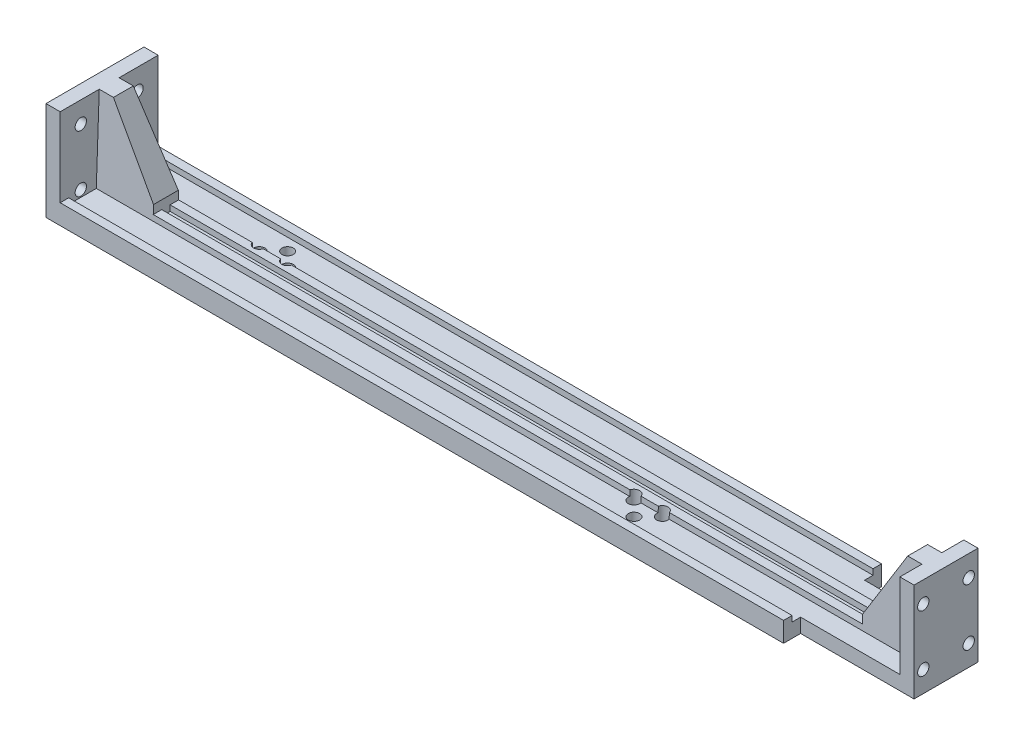
from build123d import *

# Parameters (mm, degrees)
EXTRUDE_1_DEPTH          = 34.54
CUT_EXTRUDE_1_REACH      = 305.978
SKETCH_2_W               = 40
SKETCH_2_H               = 6
SKETCH_3_R               = 2
CUT_EXTRUDE_2_DEPTH      = 5
SKETCH_4_R               = 2
CUT_EXTRUDE_3_DEPTH      = 5
RIB_START                = 5
RIB_7_DEPTH              = 20
RIB_START_2              = 12.730059485
RIB_7_2_DEPTH            = 9.07988103
RIB_START_3              = 275
RIB_19_DEPTH             = 20
RIB_START_4              = 147.269934089
RIB_19_2_DEPTH           = 35.576868781
EXTRUDE_2_REACH          = 301.045
SKETCH_8_W               = 3
SKETCH_8_H               = 2
CUT_EXTRUDE_4_DEPTH      = 304.978058419
CUT_EXTRUDE_4_DEPTH_BACK = 304.978058419
SKETCH_9_W               = 35
SKETCH_9_H               = 3
CUT_EXTRUDE_5_REACH      = 305.978
SKETCH_10_R              = 2
CUT_EXTRUDE_6_REACH      = 305.978
SKETCH_11_R              = 2


with BuildPart() as part:
    # 草图1 → 凸台-拉伸1 (new body)
    with BuildSketch(Plane.XY):
        Polygon((0, 0), (300, 0), (300, 34.78), (295, 34.78), (295, 5), (5, 5), (5, 34.78), (0, 34.78), align=None)
    extrude(amount=EXTRUDE_1_DEPTH)

    # 切除-拉伸1: up to this face of the body (flat: up to its plane)
    cut_extrude_1_end = Plane(part.part.faces().sort_by_distance((297.5, 34.78, 17.27))[0])
    # 草图2 → 切除-拉伸1 (cut, up to the picked face)
    with BuildSketch(Plane.XZ, mode=Mode.PRIVATE) as cut_extrude_1_sk1:
        with Locations((280, 31.54)):
            Rectangle(SKETCH_2_W, SKETCH_2_H)
    cut_extrude_1_tool1 = split(extrude(cut_extrude_1_sk1.sketch, amount=-CUT_EXTRUDE_1_REACH, mode=Mode.PRIVATE), bisect_by=cut_extrude_1_end, keep=Keep.BOTH, mode=Mode.PRIVATE)
    # 草图2 → 切除-拉伸1 (cut, up to the picked face)
    with BuildSketch(Plane.XZ, mode=Mode.PRIVATE) as cut_extrude_1_sk2:
        with Locations((280, 3)):
            Rectangle(SKETCH_2_W, SKETCH_2_H)
    cut_extrude_1_tool2 = split(extrude(cut_extrude_1_sk2.sketch, amount=-CUT_EXTRUDE_1_REACH, mode=Mode.PRIVATE), bisect_by=cut_extrude_1_end, keep=Keep.BOTH, mode=Mode.PRIVATE)
    add(cut_extrude_1_tool1.solids().sort_by(Axis((280, 0, 31.54), (0, 1, 0)))[0], mode=Mode.SUBTRACT)
    add(cut_extrude_1_tool2.solids().sort_by(Axis((280, 0, 3), (0, 1, 0)))[0], mode=Mode.SUBTRACT)

    # 草图3 → 切除-拉伸2 (cut)
    with BuildSketch(Plane(origin=(300, 0, 0), x_dir=(0, 0, -1), z_dir=(1, 0, 0))):
        with Locations((-25.27, 7.39)):
            Circle(SKETCH_3_R)
        with Locations((-25.27, 27.39)):
            Circle(SKETCH_3_R)
        with Locations((-9.27, 27.39)):
            Circle(SKETCH_3_R)
        with Locations((-9.27, 7.39)):
            Circle(SKETCH_3_R)
    extrude(amount=-CUT_EXTRUDE_2_DEPTH, mode=Mode.SUBTRACT)

    # 草图4 → 切除-拉伸3 (cut)
    with BuildSketch(Plane.ZY):
        with Locations(Location((7.27, 27.39, 0), (0, 0, 270))):
            Circle(SKETCH_4_R)
        with Locations(Location((27.27, 27.39, 0), (0, 0, 270))):
            Circle(SKETCH_4_R)
        with Locations(Location((27.27, 7.39, 0), (0, 0, 270))):
            Circle(SKETCH_4_R)
        with Locations(Location((7.27, 7.39, 0), (0, 0, 270))):
            Circle(SKETCH_4_R)
    extrude(amount=-CUT_EXTRUDE_3_DEPTH, mode=Mode.SUBTRACT)

    # 筋7: read off the stored shape, not the designer's step
    # 筋7 outline → 筋7 (add)
    with BuildSketch(Plane.YZ.offset(RIB_START)):
        Polygon((34.78, 13.77), (34.78, 20.77), (5, 21.809940515), (5, 12.730059485), align=None)
    extrude(amount=RIB_7_DEPTH)

    # Rib 7 2 outline → Rib 7 2 (cut)
    with BuildSketch(Plane.XY.offset(RIB_START_2)):
        Polygon((25, 34.78), (10, 34.78), (25, 10), align=None)
    extrude(amount=RIB_7_2_DEPTH, mode=Mode.SUBTRACT)

    # 筋19: read off the stored shape, not the designer's step
    # 筋19 outline → 筋19 (add)
    with BuildSketch(Plane.YZ.offset(RIB_START_3)):
        Polygon((34.78, 13.77), (34.78, 20.77), (5, 21.809940515), (5, 12.730059485), align=None)
    extrude(amount=RIB_19_DEPTH)

    # Rib 19 2 outline → Rib 19 2 (cut)
    with BuildSketch(Plane(origin=(0, 0, 0), x_dir=(0.8556156704777578, -0.5172963390397041, -0.018064386206466228), z_dir=(0.5176116540736858, 0.8550944525297293, 0.02986055625713262)).offset(RIB_START_4)):
        Polygon((229.730516914, -21.273162039), (229.888231169, -12.547807193), (216, -12.547807193), (216, -23), (229.699303632, -23), align=None)
    extrude(amount=RIB_19_2_DEPTH, mode=Mode.SUBTRACT)

    # 凸台-拉伸2: up to this face of the body (flat: up to its plane)
    extrude_2_end = Plane(part.part.faces().sort_by_distance((295, 20.622218635, 24.86118076))[0])
    # 草图8 → 凸台-拉伸2 (add, up to the picked face)
    with BuildSketch(Plane(origin=(5, 0, 0), x_dir=(0, 0, -1), z_dir=(1, 0, 0)), mode=Mode.PRIVATE) as extrude_2_sk1:
        with Locations((-33.04, 6)):
            Rectangle(SKETCH_8_W, SKETCH_8_H)
    extrude_2_tool1 = split(extrude(extrude_2_sk1.sketch, amount=EXTRUDE_2_REACH, mode=Mode.PRIVATE), bisect_by=extrude_2_end, keep=Keep.BOTH, mode=Mode.PRIVATE)
    # 草图8 → 凸台-拉伸2 (add, up to the picked face)
    with BuildSketch(Plane(origin=(5, 0, 0), x_dir=(0, 0, -1), z_dir=(1, 0, 0)), mode=Mode.PRIVATE) as extrude_2_sk2:
        Polygon((-21.740098976, 7), (-21.809940515, 5), (-18.740098976, 5), (-18.740098976, 7), align=None)
    extrude_2_tool2 = split(extrude(extrude_2_sk2.sketch, amount=EXTRUDE_2_REACH, mode=Mode.PRIVATE), bisect_by=extrude_2_end, keep=Keep.BOTH, mode=Mode.PRIVATE)
    # 草图8 → 凸台-拉伸2 (add, up to the picked face)
    with BuildSketch(Plane(origin=(5, 0, 0), x_dir=(0, 0, -1), z_dir=(1, 0, 0)), mode=Mode.PRIVATE) as extrude_2_sk3:
        Polygon((-15.799901024, 7), (-15.799901024, 5), (-12.730059485, 5), (-12.799901024, 7), align=None)
    extrude_2_tool3 = split(extrude(extrude_2_sk3.sketch, amount=EXTRUDE_2_REACH, mode=Mode.PRIVATE), bisect_by=extrude_2_end, keep=Keep.BOTH, mode=Mode.PRIVATE)
    # 草图8 → 凸台-拉伸2 (add, up to the picked face)
    with BuildSketch(Plane(origin=(5, 0, 0), x_dir=(0, 0, -1), z_dir=(1, 0, 0)), mode=Mode.PRIVATE) as extrude_2_sk4:
        with Locations((-1.5, 6)):
            Rectangle(SKETCH_8_W, SKETCH_8_H)
    extrude_2_tool4 = split(extrude(extrude_2_sk4.sketch, amount=EXTRUDE_2_REACH, mode=Mode.PRIVATE), bisect_by=extrude_2_end, keep=Keep.BOTH, mode=Mode.PRIVATE)
    add(extrude_2_tool1.solids().sort_by(Axis((5, 6, 33.04), (1, 0, 0)))[0])
    add(extrude_2_tool2.solids().sort_by(Axis((5, 5.996165, 20.257626), (1, 0, 0)))[0])
    add(extrude_2_tool3.solids().sort_by(Axis((5, 5.996165, 14.282374), (1, 0, 0)))[0])
    add(extrude_2_tool4.solids().sort_by(Axis((5, 6, 1.5), (1, 0, 0)))[0])

    # 草图9 → 切除-拉伸4 (cut, two sides: drawn at the far end of the back side and taken through both)
    with BuildSketch(Plane.XZ.offset(-CUT_EXTRUDE_4_DEPTH_BACK)):
        with Locations((277.5, 1.5)):
            Rectangle(SKETCH_9_W, SKETCH_9_H)
        with Locations((277.5, 33.04)):
            Rectangle(SKETCH_9_W, SKETCH_9_H)
    extrude(amount=CUT_EXTRUDE_4_DEPTH + CUT_EXTRUDE_4_DEPTH_BACK, mode=Mode.SUBTRACT)

    # 切除-拉伸5: up to this face of the body (flat: up to its plane)
    cut_extrude_5_end = Plane(part.part.faces().sort_by_distance((132.5, 7, 33.04))[0])
    # 草图10 → 切除-拉伸5 (cut, up to the picked face)
    with BuildSketch(Plane.XZ, mode=Mode.PRIVATE) as cut_extrude_5_sk1:
        with Locations(Location((205, 22.27, 0), (0, 0, 270))):
            Circle(SKETCH_10_R)
    cut_extrude_5_tool1 = split(extrude(cut_extrude_5_sk1.sketch, amount=-CUT_EXTRUDE_5_REACH, mode=Mode.PRIVATE), bisect_by=cut_extrude_5_end, keep=Keep.BOTH, mode=Mode.PRIVATE)
    # 草图10 → 切除-拉伸5 (cut, up to the picked face)
    with BuildSketch(Plane.XZ, mode=Mode.PRIVATE) as cut_extrude_5_sk2:
        with Locations(Location((200, 27.27, 0), (0, 0, 270))):
            Circle(SKETCH_10_R)
    cut_extrude_5_tool2 = split(extrude(cut_extrude_5_sk2.sketch, amount=-CUT_EXTRUDE_5_REACH, mode=Mode.PRIVATE), bisect_by=cut_extrude_5_end, keep=Keep.BOTH, mode=Mode.PRIVATE)
    # 草图10 → 切除-拉伸5 (cut, up to the picked face)
    with BuildSketch(Plane.XZ, mode=Mode.PRIVATE) as cut_extrude_5_sk3:
        with Locations(Location((195, 22.27, 0), (0, 0, 270))):
            Circle(SKETCH_10_R)
    cut_extrude_5_tool3 = split(extrude(cut_extrude_5_sk3.sketch, amount=-CUT_EXTRUDE_5_REACH, mode=Mode.PRIVATE), bisect_by=cut_extrude_5_end, keep=Keep.BOTH, mode=Mode.PRIVATE)
    add(cut_extrude_5_tool1.solids().sort_by(Axis((205, 0, 22.27), (0, 1, 0)))[0], mode=Mode.SUBTRACT)
    add(cut_extrude_5_tool2.solids().sort_by(Axis((200, 0, 27.27), (0, 1, 0)))[0], mode=Mode.SUBTRACT)
    add(cut_extrude_5_tool3.solids().sort_by(Axis((195, 0, 22.27), (0, 1, 0)))[0], mode=Mode.SUBTRACT)

    # 切除-拉伸6: up to this face of the body (flat: up to its plane)
    cut_extrude_6_end = Plane(part.part.faces().sort_by_distance((150, 7, 14.299901024))[0])
    # 草图11 → 切除-拉伸6 (cut, up to the picked face)
    with BuildSketch(Plane.XZ, mode=Mode.PRIVATE) as cut_extrude_6_sk1:
        with Locations(Location((52.9, 12.27, 0), (0, 0, 270))):
            Circle(SKETCH_11_R)
    cut_extrude_6_tool1 = split(extrude(cut_extrude_6_sk1.sketch, amount=-CUT_EXTRUDE_6_REACH, mode=Mode.PRIVATE), bisect_by=cut_extrude_6_end, keep=Keep.BOTH, mode=Mode.PRIVATE)
    # 草图11 → 切除-拉伸6 (cut, up to the picked face)
    with BuildSketch(Plane.XZ, mode=Mode.PRIVATE) as cut_extrude_6_sk2:
        with Locations(Location((62.9, 12.27, 0), (0, 0, 270))):
            Circle(SKETCH_11_R)
    cut_extrude_6_tool2 = split(extrude(cut_extrude_6_sk2.sketch, amount=-CUT_EXTRUDE_6_REACH, mode=Mode.PRIVATE), bisect_by=cut_extrude_6_end, keep=Keep.BOTH, mode=Mode.PRIVATE)
    # 草图11 → 切除-拉伸6 (cut, up to the picked face)
    with BuildSketch(Plane.XZ, mode=Mode.PRIVATE) as cut_extrude_6_sk3:
        with Locations(Location((57.9, 7.27, 0), (0, 0, 270))):
            Circle(SKETCH_11_R)
    cut_extrude_6_tool3 = split(extrude(cut_extrude_6_sk3.sketch, amount=-CUT_EXTRUDE_6_REACH, mode=Mode.PRIVATE), bisect_by=cut_extrude_6_end, keep=Keep.BOTH, mode=Mode.PRIVATE)
    add(cut_extrude_6_tool1.solids().sort_by(Axis((52.9, 0, 12.27), (0, 1, 0)))[0], mode=Mode.SUBTRACT)
    add(cut_extrude_6_tool2.solids().sort_by(Axis((62.9, 0, 12.27), (0, 1, 0)))[0], mode=Mode.SUBTRACT)
    add(cut_extrude_6_tool3.solids().sort_by(Axis((57.9, 0, 7.27), (0, 1, 0)))[0], mode=Mode.SUBTRACT)


solid = part.part
